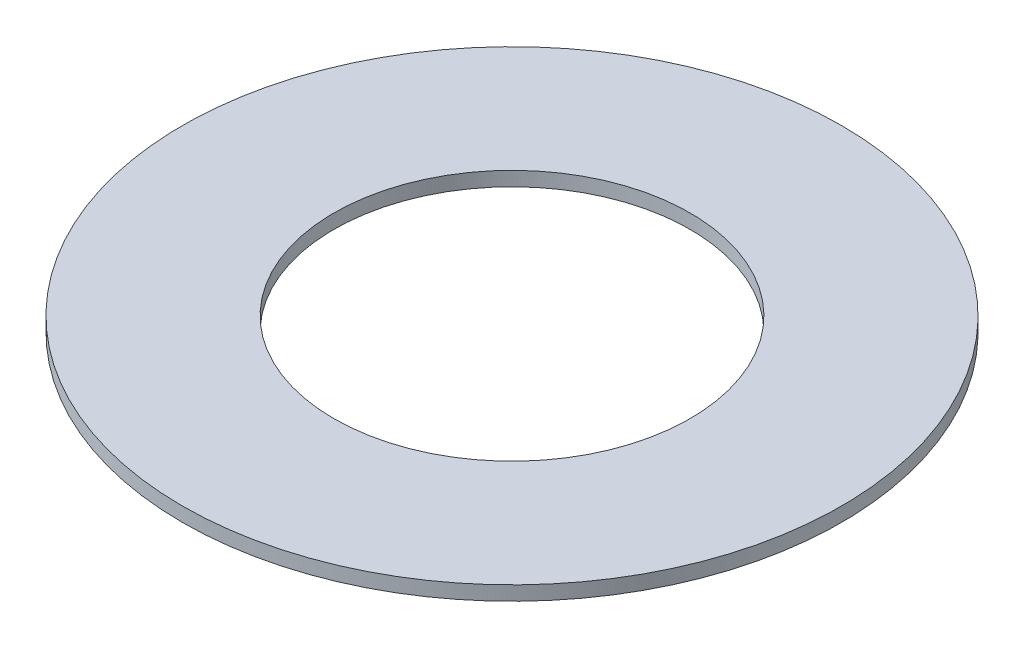
from build123d import *

# Parameters (mm, degrees)
SKETCH1_R           = 92.5
BOSS_EXTRUDE1_DEPTH = 4
SKETCH2_R           = 50
CUT_EXTRUDE1_DEPTH  = 131.875895412


with BuildPart() as part:
    # Sketch1 → Boss-Extrude1 (new body)
    with BuildSketch(Plane(origin=(0, 0, 0), x_dir=(1, 0, 0), z_dir=(0, 1, 0))):
        Circle(SKETCH1_R)
    extrude(amount=BOSS_EXTRUDE1_DEPTH)

    # Sketch2 → Cut-Extrude1 (cut, through all)
    with BuildSketch(Plane(origin=(0, 0, 0), x_dir=(1, 0, 0), z_dir=(0, 1, 0))):
        Circle(SKETCH2_R)
    extrude(amount=CUT_EXTRUDE1_DEPTH, mode=Mode.SUBTRACT)


solid = part.part
